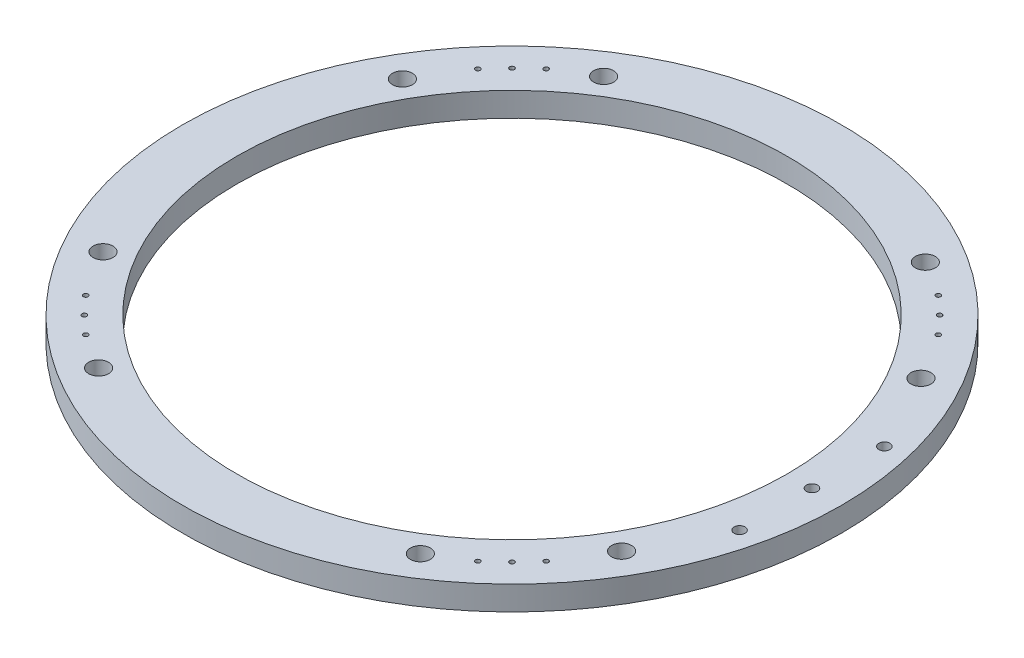
from build123d import *

# Parameters (mm, degrees)
TAP_DRILL_FOR_M3X0_5_TAP1_D = 2.5
CIRPATTERN1_COUNT           = 4
M5_CLEARANCE_HOLE1_D        = 5.8
Z_0_413_DIAMETER_HOLE1_D    = 10.4902


with BuildPart() as part:
    # Sketch1 → Revolve1 (revolve)
    with BuildSketch(Plane.XY):
        Polygon((144.78715491, 1022.553200068), (144.78715491, 1009.853200068), (152.4, 1009.853200068), (173.36215491, 1009.853200068), (173.36215491, 1022.553200068), align=None)
    revolve(axis=Axis((0, 1125.81516809, 0), (0, -1, 0)))

    # Tap Drill for M3x0.5 Tap1 (through all)
    with Locations(Plane(origin=(0, 1009.853200068, 0), x_dir=(-1, 0, 0), z_dir=(0, -1, 0))):
        with Locations((103.143460894, 121.103973136), (121.103973136, 103.143460894), (112.482767201, 112.482767201)):
            tap_drill_for_m3x0_5_tap1 = Hole(TAP_DRILL_FOR_M3X0_5_TAP1_D / 2)

    # CirPattern1: Tap Drill for M3x0.5 Tap1 ×4 about axis
    cirpattern1_axis = Axis((0, 1125.81516809, 0), (0, 1, 0))
    for i in range(1, CIRPATTERN1_COUNT):
        add(tap_drill_for_m3x0_5_tap1.rotate(cirpattern1_axis, i * 360 / CIRPATTERN1_COUNT), mode=Mode.SUBTRACT)

    # M5 Clearance Hole1 (through all)
    with Locations(Plane(origin=(0, 1022.553200068, 0), x_dir=(1, 0, 0), z_dir=(0, 1, 0))):
        with Locations((157.7975, -38.1), (157.7975, 0), (157.7975, 38.1)):
            Hole(M5_CLEARANCE_HOLE1_D / 2)

    # Z (0.413) Diameter Hole1 (through all)
    with Locations(Plane(origin=(0, 1022.553200068, 0), x_dir=(1, 0, 0), z_dir=(0, 1, 0))):
        with Locations((-136.387876921, -78.743577455), (136.387876921, -78.743577455), (136.387876921, 78.743577455), (-136.387876921, 78.743577455), (-84.617786653, 132.823319276), (84.617786653, 132.823319276), (84.617786653, -132.823319276), (-84.617786653, -132.823319276)):
            Hole(Z_0_413_DIAMETER_HOLE1_D / 2)


solid = part.part
